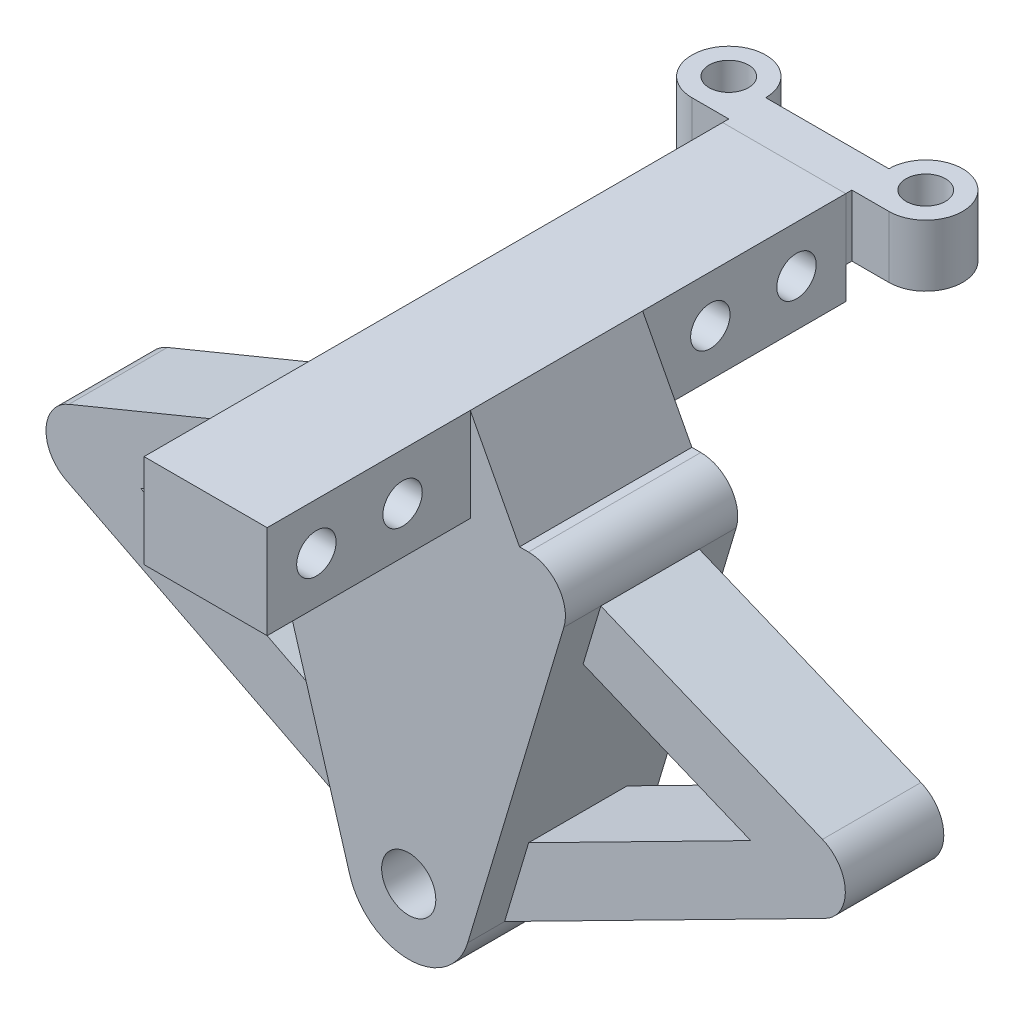
from build123d import *

# Parameters (mm, degrees)
SKETCH_1_W             = 47
SKETCH_1_H             = 7.6
SKETCH_1_R             = 1.6
EXTRUDE_1_DEPTH        = 5
EXTRUDE_3_DEPTH        = 7
SKETCH_3_R             = 2.2
EXTRUDE_2_DEPTH        = 7
FILLET_1_R             = 5
FILLET_2_R             = 3
EXTRUDE_4_DEPTH        = 4
FILLET_3_R             = 3
FILLET_3_OF_MIRROR_1_R = 3
SKETCH_6_R             = 1.6
EXTRUDE_5_DEPTH        = 5


with BuildPart() as part:
    # 草图1 → 凸台-拉伸1 (new, symmetric)
    with BuildSketch(Plane(origin=(0, 0, 0), x_dir=(0, 0, -1), z_dir=(1, 0, 0))):
        Rectangle(SKETCH_1_W, SKETCH_1_H)
        with Locations((-19.5, 0)):
            Circle(SKETCH_1_R, mode=Mode.SUBTRACT)
        with Locations((-12.5, 0)):
            Circle(SKETCH_1_R, mode=Mode.SUBTRACT)
        with Locations((12.5, 0)):
            Circle(SKETCH_1_R, mode=Mode.SUBTRACT)
        with Locations((19.5, 0)):
            Circle(SKETCH_1_R, mode=Mode.SUBTRACT)
    extrude(amount=EXTRUDE_1_DEPTH, both=True)

    # 草图4 → 凸台-拉伸3 (add, symmetric)
    with BuildSketch(Plane.XY):
        Polygon((5, 3.8), (5, -3.8), (9, -3.8), align=None)
        Polygon((-5, -3.8), (-9, -3.8), (-5, 3.8), align=None)
    extrude(amount=EXTRUDE_3_DEPTH, both=True)

    # 草图3 → 凸台-拉伸2 (add, symmetric)
    with BuildSketch(Plane.XY):
        Polygon((0, -3.8), (-13.756900678, -3.8), (0, -49.766728974), (13.756900678, -3.8), align=None)
        with Locations((0, -32.020277262)):
            Circle(SKETCH_3_R, mode=Mode.SUBTRACT)
    extrude(amount=EXTRUDE_2_DEPTH, both=True)

    # 圆角1
    fillet_1_edges = [part.edges().sort_by_distance(p)[0] for p in [
        (0, -49.766728974, 0),
    ]]
    fillet(fillet_1_edges, radius=FILLET_1_R)

    # 圆角2
    fillet_2_edges = [part.edges().sort_by_distance(p)[0] for p in [
        (-13.756900678, -3.8, 0),
        (13.756900678, -3.8, 0),
    ]]
    fillet(fillet_2_edges, radius=FILLET_2_R)

    # 草图5 → 凸台-拉伸4 (add, symmetric)
    with BuildSketch(Plane.XY):
        Polygon((-12.6016387, -7.660143754), (-36.64770265, -17.562543764), (-4.790080237, -33.761356459), (-6.740083912, -27.245696244), (-24.782770498, -18.071436573), (-11.164189994, -12.463174365), align=None)
    extrude_4 = extrude(amount=EXTRUDE_4_DEPTH, both=True)

    # 圆角3
    fillet_3_edges = [part.edges().sort_by_distance(p)[0] for p in [
        (-36.64770265, -17.562543764, 0),
    ]]
    fillet(fillet_3_edges, radius=FILLET_3_R)

    # 镜向1: 凸台-拉伸4 across plane
    add(extrude_4.mirror(Plane(origin=(0, 0, 0), x_dir=(0, 0, 1), z_dir=(1, 0, 0))))

    # 圆角3 of 镜向1
    fillet_3_of_mirror_1_edges = [part.edges().sort_by_distance(p)[0] for p in [
        (36.64770265, -17.562543764, 0),
    ]]
    fillet(fillet_3_of_mirror_1_edges, radius=FILLET_3_OF_MIRROR_1_R)


with BuildPart() as body_2:
    # 草图6 → 凸台-拉伸5 (new body)
    with BuildSketch(Plane(origin=(0, 3.8, 0), x_dir=(1, 0, 0), z_dir=(0, 1, 0))):
        with BuildLine():
            Line((-5, 23.5), (-5, 24))
            Line((-5, 24), (-8, 24))
            ThreePointArc((-8, 24), (-10.121320344, 29.121320344), (-5, 27))
            Line((-5, 27), (5, 27))
            ThreePointArc((5, 27), (10.121320344, 29.121320344), (8, 24))
            Line((8, 24), (5, 24))
            Line((5, 24), (5, 23.5))
            Line((5, 23.5), (-5, 23.5))
        make_face()
        with Locations((-8, 27)):
            Circle(SKETCH_6_R, mode=Mode.SUBTRACT)
        with Locations((8, 27)):
            Circle(SKETCH_6_R, mode=Mode.SUBTRACT)
    extrude(amount=-EXTRUDE_5_DEPTH)


solid = Compound([part.part, body_2.part])
